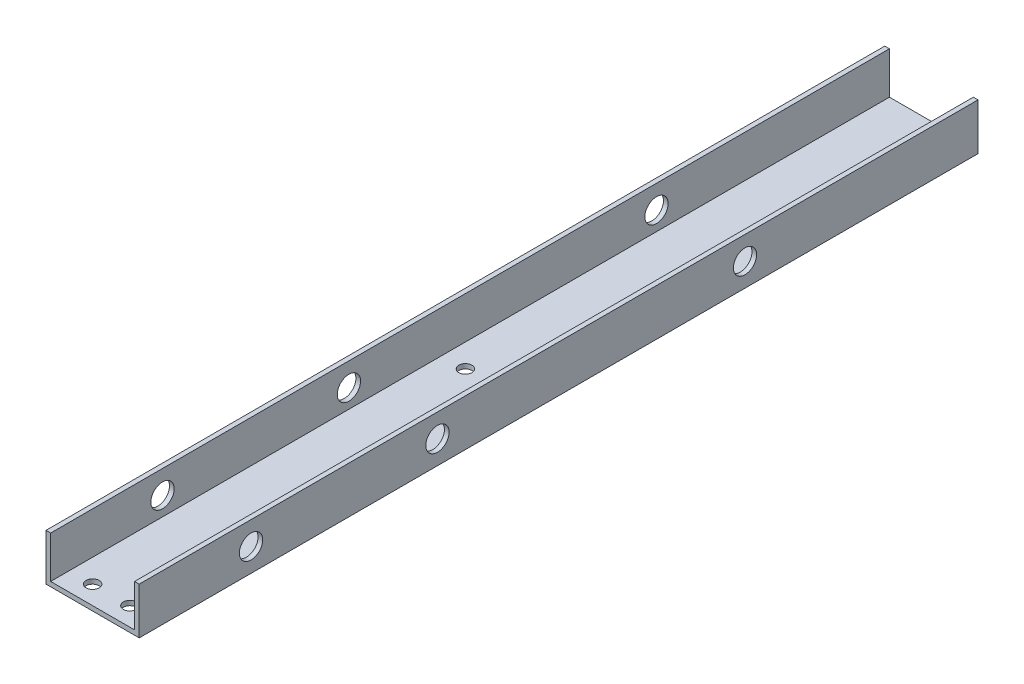
from build123d import *

# Parameters (mm, degrees)
BOSS_EXTRUDE1_DEPTH = 457.2
CUT_EXTRUDE1_REACH  = 462.714
SKETCH2_R           = 3.556
CUT_EXTRUDE2_REACH  = 462.714
SKETCH3_R           = 3.556
SKETCH4_R           = 6.35
CUT_EXTRUDE3_DEPTH  = 461.714271539


with BuildPart() as part:
    # Sketch1 → Boss-Extrude1 (new body)
    with BuildSketch(Plane.XY):
        Polygon((48.26, 2.54), (48.26, 25.4), (50.8, 25.4), (50.8, 0), (0, 0), (0, 25.4), (2.54, 25.4), (2.54, 2.54), align=None)
    extrude(amount=BOSS_EXTRUDE1_DEPTH)

    # Sketch2 → Cut-Extrude1 (cut, up to next)
    with BuildSketch(Plane.XZ, mode=Mode.PRIVATE) as cut_extrude1_sk1:
        with Locations((15.24, 447.04)):
            Circle(SKETCH2_R)
    cut_extrude1_tool1 = extrude(cut_extrude1_sk1.sketch, amount=-CUT_EXTRUDE1_REACH, mode=Mode.PRIVATE) & part.part
    # Sketch2 → Cut-Extrude1 (cut, up to next)
    with BuildSketch(Plane.XZ, mode=Mode.PRIVATE) as cut_extrude1_sk2:
        with Locations((35.56, 447.04)):
            Circle(SKETCH2_R)
    cut_extrude1_tool2 = extrude(cut_extrude1_sk2.sketch, amount=-CUT_EXTRUDE1_REACH, mode=Mode.PRIVATE) & part.part
    add(cut_extrude1_tool1.solids().sort_by_distance((15.24, 0, 447.04))[0], mode=Mode.SUBTRACT)
    add(cut_extrude1_tool2.solids().sort_by_distance((35.56, 0, 447.04))[0], mode=Mode.SUBTRACT)

    # Sketch3 → Cut-Extrude2 (cut, up to next)
    with BuildSketch(Plane.XZ, mode=Mode.PRIVATE) as cut_extrude2_sk1:
        with Locations((15.24, 243.84)):
            Circle(SKETCH3_R)
    cut_extrude2_tool1 = extrude(cut_extrude2_sk1.sketch, amount=-CUT_EXTRUDE2_REACH, mode=Mode.PRIVATE) & part.part
    # Sketch3 → Cut-Extrude2 (cut, up to next)
    with BuildSketch(Plane.XZ, mode=Mode.PRIVATE) as cut_extrude2_sk2:
        with Locations((35.56, 243.84)):
            Circle(SKETCH3_R)
    cut_extrude2_tool2 = extrude(cut_extrude2_sk2.sketch, amount=-CUT_EXTRUDE2_REACH, mode=Mode.PRIVATE) & part.part
    add(cut_extrude2_tool1.solids().sort_by_distance((15.24, 0, 243.84))[0], mode=Mode.SUBTRACT)
    add(cut_extrude2_tool2.solids().sort_by_distance((35.56, 0, 243.84))[0], mode=Mode.SUBTRACT)

    # Sketch4 → Cut-Extrude3 (cut, through all)
    with BuildSketch(Plane.ZY):
        with Locations((396.24, 12.7)):
            Circle(SKETCH4_R)
        with Locations((294.64, 12.7)):
            Circle(SKETCH4_R)
        with Locations((127, 12.7)):
            Circle(SKETCH4_R)
    extrude(amount=-CUT_EXTRUDE3_DEPTH, mode=Mode.SUBTRACT)


solid = part.part
